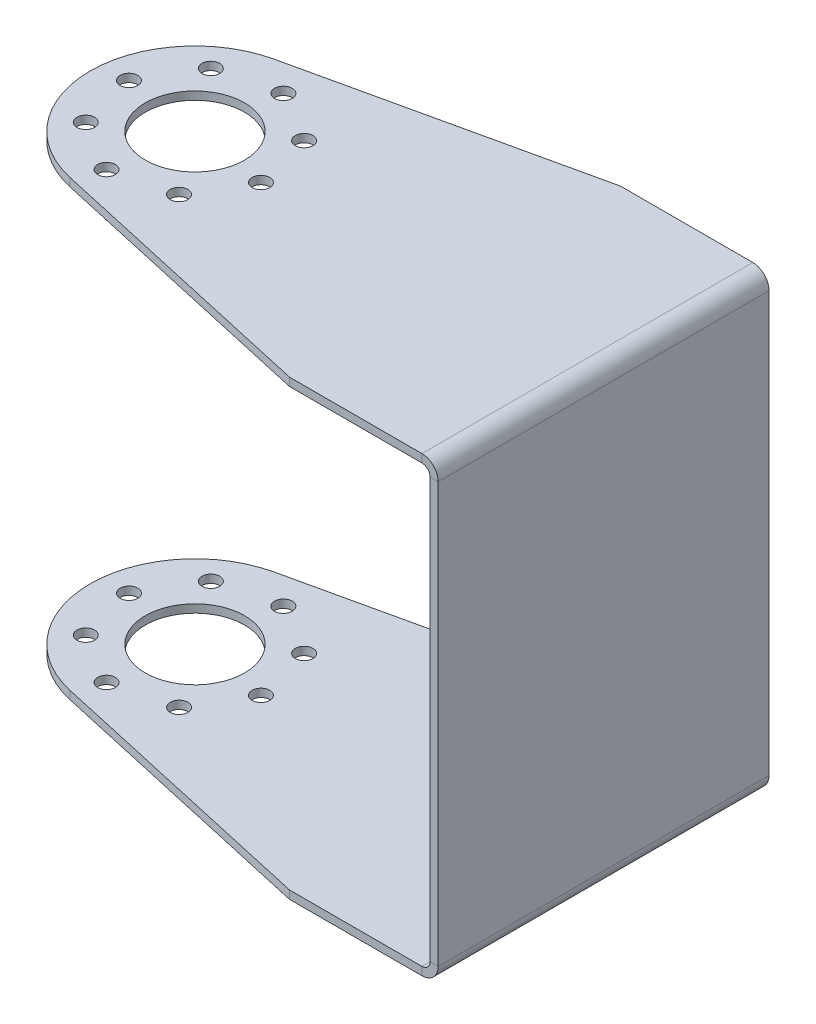
from build123d import *

# Parameters (mm, degrees)
T_LE_DE_BASE_PLI_E1_DEPTH = 30
ESQUISSE13_R              = 4.5
ESQUISSE13_R_2            = 0.8
ENL_V_MAT_EXTRU_2_DEPTH   = 72.281133549


# Sheet-metal steps are written as plain solids
with BuildPart() as part:
    # Esquisse1 → Tôle de base pliée1 (new body)
    with BuildSketch(Plane.XY):
        with BuildLine():
            Line((-50, 20.5), (-1.4732, 20.5))
            ThreePointArc((-1.4732, 20.5), (-0.43149029, 20.06850971), (0, 19.0268))
            Line((0, 19.0268), (0, -19.0268))
            ThreePointArc((0, -19.0268), (-0.43149029, -20.06850971), (-1.4732, -20.5))
            Line((-1.4732, -20.5), (-50, -20.5))
            Line((-50, -20.5), (-50, -19.7634))
            Line((-50, -19.7634), (-1.4732, -19.7634))
            ThreePointArc((-1.4732, -19.7634), (-0.952345145, -19.547654855), (-0.7366, -19.0268))
            Line((-0.7366, -19.0268), (-0.7366, 19.0268))
            ThreePointArc((-0.7366, 19.0268), (-0.952345145, 19.547654855), (-1.4732, 19.7634))
            Line((-1.4732, 19.7634), (-50, 19.7634))
            Line((-50, 19.7634), (-50, 20.5))
        make_face()
    extrude(amount=T_LE_DE_BASE_PLI_E1_DEPTH)

    # Esquisse13 → Enlèv. mat.-Extru.2 (cut, through all)
    with BuildSketch(Plane.XZ.offset(20.5)):
        with BuildLine():
            ThreePointArc((-46.549919552, 15), (-44.463516741, 20.940418901), (-39.120745506, 24.271552182))
            Line((-39.120745506, 24.271552182), (-13.4732, 30))
            Line((-13.4732, 30), (-50, 30))
            Line((-50, 30), (-50, 15))
            Line((-50, 15), (-46.549919552, 15))
        make_face()
        with BuildLine():
            Line((-13.4732, 0), (-39.120745506, 5.728447818))
            ThreePointArc((-39.120745506, 5.728447818), (-44.463516741, 9.059581099), (-46.549919552, 15))
            Line((-46.549919552, 15), (-50, 15))
            Line((-50, 15), (-50, 0))
            Line((-50, 0), (-13.4732, 0))
        make_face()
        with Locations((-37.049919552, 15)):
            Circle(ESQUISSE13_R)
        with Locations((-30.049919552, 16.017866465)):
            Circle(ESQUISSE13_R_2)
        with Locations((-32.819912364, 20.669487748)):
            Circle(ESQUISSE13_R_2)
        with Locations((-38.067786017, 22)):
            Circle(ESQUISSE13_R_2)
        with Locations((-42.7194073, 19.230007189)):
            Circle(ESQUISSE13_R_2)
        with Locations((-44.049919552, 13.982133535)):
            Circle(ESQUISSE13_R_2)
        with Locations((-41.279926741, 9.330512252)):
            Circle(ESQUISSE13_R_2)
        with Locations((-36.032053088, 8)):
            Circle(ESQUISSE13_R_2)
        with Locations((-31.380431805, 10.769992811)):
            Circle(ESQUISSE13_R_2)
    extrude(amount=-ENL_V_MAT_EXTRU_2_DEPTH, mode=Mode.SUBTRACT)


solid = part.part
